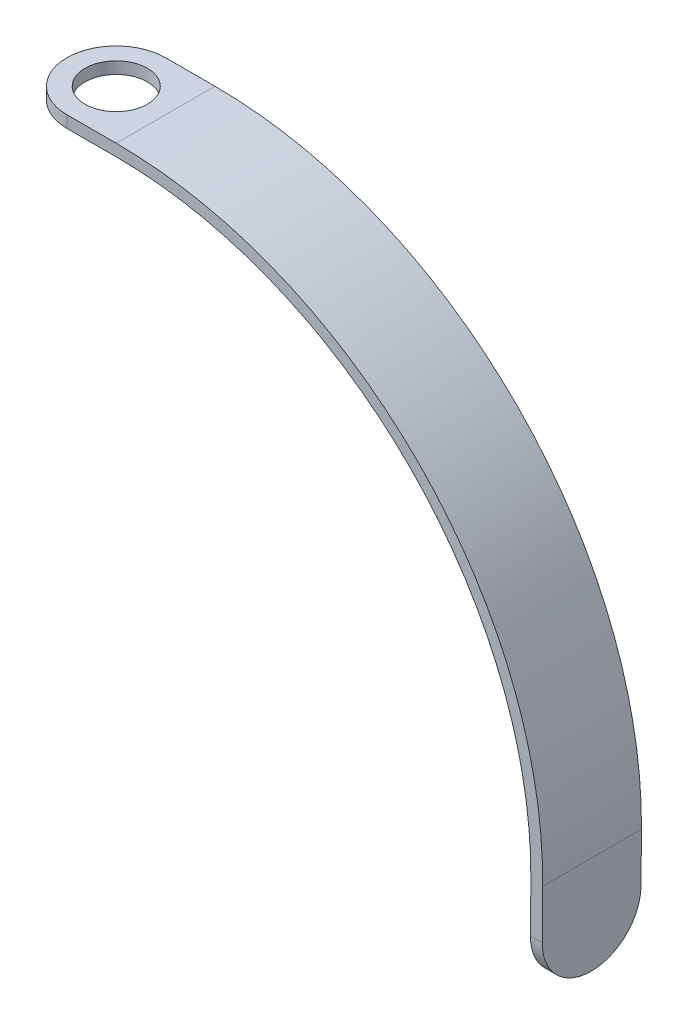
from build123d import *

# Parameters (mm, degrees)
BOSS_EXTRUDE1_DEPTH = 25
FILLET1_R           = 12.5
CUT_EXTRUDE1_REACH  = 175.866
SKETCH3_R           = 7.89
SKETCH4_R           = 3.225
BOSS_EXTRUDE2_DEPTH = 6


with BuildPart() as part:
    # Sketch2 → Boss-Extrude1 (new body)
    with BuildSketch(Plane.XY):
        with BuildLine():
            Line((0, 108), (-25, 108))
            Line((-25, 108), (-25, 105))
            Line((-25, 105), (0, 105))
            ThreePointArc((0, 105), (74.56946444, 73.921546068), (104.996001922, -0.916286227))
            Line((104.996001922, -0.916286227), (104.777838534, -25.915334304))
            Line((104.777838534, -25.915334304), (107.777724303, -25.94151391))
            Line((107.777724303, -25.94151391), (107.995887691, -0.942465834))
            ThreePointArc((107.995887691, -0.942465834), (76.700020567, 76.033590241), (0, 108))
        make_face()
    extrude(amount=BOSS_EXTRUDE1_DEPTH)

    # Fillet1
    fillet1_edges = [part.edges().sort_by_distance(p)[0] for p in [
        (106.277781419, -25.928424107, 0),
        (106.277781419, -25.928424107, 25),
        (-25, 106.5, 25),
        (-25, 106.5, 0),
    ]]
    fillet(fillet1_edges, radius=FILLET1_R - 0.0001)  # a hair under: the kernel refuses the full size

    # Sketch3 → Cut-Extrude1 (cut, up to next)
    with BuildSketch(Plane(origin=(0, 108, 0), x_dir=(1, 0, 0), z_dir=(0, 1, 0)), mode=Mode.PRIVATE) as cut_extrude1_sk1:
        with Locations(Location((-12.5, -12.5, 0), (0, 0, 270))):
            Circle(SKETCH3_R)
    cut_extrude1_tool1 = extrude(cut_extrude1_sk1.sketch, amount=-CUT_EXTRUDE1_REACH, mode=Mode.PRIVATE) & part.part
    add(cut_extrude1_tool1.solids().sort_by_distance((-12.5, 108, 12.5))[0], mode=Mode.SUBTRACT)

    # Sketch4 → Boss-Extrude2 (add)
    with BuildSketch(Plane(origin=(104.996001922, -0.916286227, 0), x_dir=(0, 0, -1), z_dir=(0.9999619230641714, -0.008726535498378436, 0))):
        with Locations(Location((-12.5, -12.5, 0), (0, 0, 90))):
            Circle(SKETCH4_R)
    extrude(amount=-BOSS_EXTRUDE2_DEPTH)


solid = part.part
